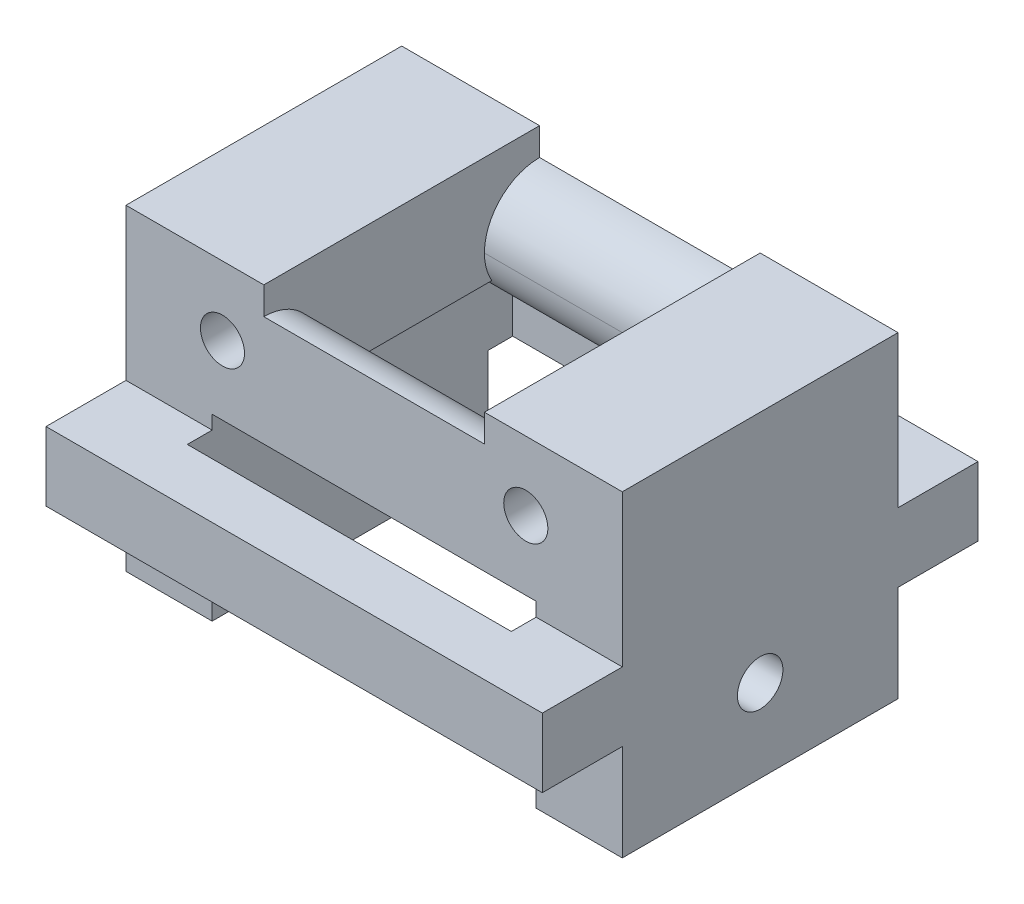
from build123d import *

# Parameters (mm, degrees)
SKETCH1_W           = 36
SKETCH1_H           = 20
BOSS_EXTRUDE1_DEPTH = 15
SKETCH2_W           = 23.5
SKETCH2_H           = 20
CUT_EXTRUDE1_DEPTH  = 13
SKETCH3_R           = 1.65
CUT_EXTRUDE2_DEPTH  = 44.829214002
SKETCH4_W           = 20
SKETCH4_H           = 12
CUT_EXTRUDE3_DEPTH  = 44.829214002
SKETCH5_W           = 10
SKETCH5_H           = 20
BOSS_EXTRUDE2_DEPTH = 8
SKETCH6_R           = 1.6
CUT_EXTRUDE4_DEPTH  = 48.16990566
SKETCH7_W           = 16
SKETCH7_H           = 4
BOSS_EXTRUDE3_DEPTH = 6
FILLET1_R           = 4
FILLET2_R           = 4
FILLET5_R           = 4
SKETCH8_W           = 5.8
SKETCH8_H           = 5
BOSS_EXTRUDE4_DEPTH = 36
SKETCH9_W           = 23.5
SKETCH9_H           = 1.8
CUT_EXTRUDE5_DEPTH  = 48.091825193


# Some blends are built 0.0001 mm under size
with BuildPart() as part:
    # Sketch1 → Boss-Extrude1 (new body)
    with BuildSketch(Plane(origin=(0, 0, 0), x_dir=(1, 0, 0), z_dir=(0, 1, 0))):
        with Locations((18, -10)):
            Rectangle(SKETCH1_W, SKETCH1_H)
    extrude(amount=BOSS_EXTRUDE1_DEPTH)

    # Sketch2 → Cut-Extrude1 (cut)
    with BuildSketch(Plane(origin=(0, 0, 0), x_dir=(-1, 0, 0), z_dir=(0, -1, 0))):
        with Locations((-18, -10)):
            Rectangle(SKETCH2_W, SKETCH2_H)
    extrude(amount=-CUT_EXTRUDE1_DEPTH, mode=Mode.SUBTRACT)

    # Sketch3 → Cut-Extrude2 (cut, through all)
    with BuildSketch(Plane.ZY):
        with Locations((10, 6)):
            Circle(SKETCH3_R)
    extrude(amount=-CUT_EXTRUDE2_DEPTH, mode=Mode.SUBTRACT)

    # Sketch4 → Cut-Extrude3 (cut, through all)
    with BuildSketch(Plane(origin=(0, 15, 0), x_dir=(1, 0, 0), z_dir=(0, 1, 0))):
        with Locations((18, -10)):
            Rectangle(SKETCH4_W, SKETCH4_H)
    extrude(amount=-CUT_EXTRUDE3_DEPTH, mode=Mode.SUBTRACT)

    # Sketch5 → Boss-Extrude2 (add)
    with BuildSketch(Plane(origin=(0, 15, 0), x_dir=(1, 0, 0), z_dir=(0, 1, 0))):
        with Locations((31, -10)):
            Rectangle(SKETCH5_W, SKETCH5_H)
        with Locations((5, -10)):
            Rectangle(SKETCH5_W, SKETCH5_H)
    extrude(amount=BOSS_EXTRUDE2_DEPTH)

    # Sketch6 → Cut-Extrude4 (cut, through all)
    with BuildSketch(Plane(origin=(0, 0, 0), x_dir=(-1, 0, 0), z_dir=(0, 0, -1))):
        with Locations((-29, 18)):
            Circle(SKETCH6_R)
        with Locations((-7, 18)):
            Circle(SKETCH6_R)
    extrude(amount=-CUT_EXTRUDE4_DEPTH, mode=Mode.SUBTRACT)

    # Sketch7 → Boss-Extrude3 (add)
    with BuildSketch(Plane(origin=(0, 15, 0), x_dir=(1, 0, 0), z_dir=(0, 1, 0))):
        with Locations((18, -18)):
            Rectangle(SKETCH7_W, SKETCH7_H)
        with Locations((18, -2)):
            Rectangle(SKETCH7_W, SKETCH7_H)
    extrude(amount=BOSS_EXTRUDE3_DEPTH)

    # Fillet1
    # the kernel refuses this fillet: 4 mm, written as the material it takes off along each edge
    with BuildSketch(Plane(origin=(8, 13, 16), x_dir=(0, 0, 1), z_dir=(1, 0, 0))) as fillet1_piece_1_section:
        with BuildLine():
            CenterArc((FILLET1_R, -FILLET1_R), FILLET1_R, 90, 90)
            Line((0, -FILLET1_R), (0, 0))
            Line((0, 0), (FILLET1_R, 0))
        make_face()
    fillet1_piece_1 = extrude(amount=20, mode=Mode.PRIVATE)
    fillet1_piece_1 = split(fillet1_piece_1, bisect_by=Plane(origin=(10, 13, 16), z_dir=(-1, 0, 0)), keep=Keep.TOP, mode=Mode.PRIVATE)
    fillet1_piece_1 = split(fillet1_piece_1, bisect_by=Plane(origin=(8, 15, 16), z_dir=(0, -1, 0)), keep=Keep.TOP, mode=Mode.PRIVATE)
    add(fillet1_piece_1, mode=Mode.SUBTRACT)
    with BuildSketch(Plane(origin=(8, 13, 16), x_dir=(0, 0, 1), z_dir=(1, 0, 0))) as fillet1_piece_2_section:
        with BuildLine():
            CenterArc((FILLET1_R, -FILLET1_R), FILLET1_R, 90, 90)
            Line((0, -FILLET1_R), (0, 0))
            Line((0, 0), (FILLET1_R, 0))
        make_face()
    fillet1_piece_2 = extrude(amount=20, mode=Mode.PRIVATE)
    fillet1_piece_2 = split(fillet1_piece_2, bisect_by=Plane(origin=(10, 13, 16), z_dir=(1, 0, 0)), keep=Keep.TOP, mode=Mode.PRIVATE)
    fillet1_piece_2 = split(fillet1_piece_2, bisect_by=Plane(origin=(26, 13, 16), z_dir=(-1, 0, 0)), keep=Keep.TOP, mode=Mode.PRIVATE)
    fillet1_piece_2 = split(fillet1_piece_2, bisect_by=Plane(origin=(8, 15, 16), z_dir=(0, -1, 0)), keep=Keep.TOP, mode=Mode.PRIVATE)
    add(fillet1_piece_2, mode=Mode.SUBTRACT)
    with BuildSketch(Plane(origin=(8, 13, 16), x_dir=(0, 0, 1), z_dir=(1, 0, 0))) as fillet1_piece_3_section:
        with BuildLine():
            CenterArc((FILLET1_R, -FILLET1_R), FILLET1_R, 90, 90)
            Line((0, -FILLET1_R), (0, 0))
            Line((0, 0), (FILLET1_R, 0))
        make_face()
    fillet1_piece_3 = extrude(amount=20, mode=Mode.PRIVATE)
    fillet1_piece_3 = split(fillet1_piece_3, bisect_by=Plane(origin=(10, 13, 16), z_dir=(1, 0, 0)), keep=Keep.TOP, mode=Mode.PRIVATE)
    fillet1_piece_3 = split(fillet1_piece_3, bisect_by=Plane(origin=(26, 13, 16), z_dir=(-1, 0, 0)), keep=Keep.TOP, mode=Mode.PRIVATE)
    fillet1_piece_3 = split(fillet1_piece_3, bisect_by=Plane(origin=(8, 15, 16), z_dir=(0, 1, 0)), keep=Keep.TOP, mode=Mode.PRIVATE)
    add(fillet1_piece_3, mode=Mode.SUBTRACT)
    with BuildSketch(Plane(origin=(8, 13, 16), x_dir=(0, 0, 1), z_dir=(1, 0, 0))) as fillet1_piece_4_section:
        with BuildLine():
            CenterArc((FILLET1_R, -FILLET1_R), FILLET1_R, 90, 90)
            Line((0, -FILLET1_R), (0, 0))
            Line((0, 0), (FILLET1_R, 0))
        make_face()
    fillet1_piece_4 = extrude(amount=20, mode=Mode.PRIVATE)
    fillet1_piece_4 = split(fillet1_piece_4, bisect_by=Plane(origin=(26, 13, 16), z_dir=(1, 0, 0)), keep=Keep.TOP, mode=Mode.PRIVATE)
    fillet1_piece_4 = split(fillet1_piece_4, bisect_by=Plane(origin=(8, 15, 16), z_dir=(0, -1, 0)), keep=Keep.TOP, mode=Mode.PRIVATE)
    add(fillet1_piece_4, mode=Mode.SUBTRACT)
    with BuildSketch(Plane(origin=(28, 13, 4), x_dir=(0, 0, -1), z_dir=(-1, 0, 0))) as fillet1_piece_5_section:
        with BuildLine():
            CenterArc((FILLET1_R, -FILLET1_R), FILLET1_R, 90, 90)
            Line((0, -FILLET1_R), (0, 0))
            Line((0, 0), (FILLET1_R, 0))
        make_face()
    fillet1_piece_5 = extrude(amount=20, mode=Mode.PRIVATE)
    fillet1_piece_5 = split(fillet1_piece_5, bisect_by=Plane(origin=(26, 13, 4), z_dir=(1, 0, 0)), keep=Keep.TOP, mode=Mode.PRIVATE)
    fillet1_piece_5 = split(fillet1_piece_5, bisect_by=Plane(origin=(28, 15, 4), z_dir=(0, -1, 0)), keep=Keep.TOP, mode=Mode.PRIVATE)
    add(fillet1_piece_5, mode=Mode.SUBTRACT)
    with BuildSketch(Plane(origin=(28, 13, 4), x_dir=(0, 0, -1), z_dir=(-1, 0, 0))) as fillet1_piece_6_section:
        with BuildLine():
            CenterArc((FILLET1_R, -FILLET1_R), FILLET1_R, 90, 90)
            Line((0, -FILLET1_R), (0, 0))
            Line((0, 0), (FILLET1_R, 0))
        make_face()
    fillet1_piece_6 = extrude(amount=20, mode=Mode.PRIVATE)
    fillet1_piece_6 = split(fillet1_piece_6, bisect_by=Plane(origin=(10, 13, 4), z_dir=(1, 0, 0)), keep=Keep.TOP, mode=Mode.PRIVATE)
    fillet1_piece_6 = split(fillet1_piece_6, bisect_by=Plane(origin=(26, 13, 4), z_dir=(-1, 0, 0)), keep=Keep.TOP, mode=Mode.PRIVATE)
    fillet1_piece_6 = split(fillet1_piece_6, bisect_by=Plane(origin=(28, 15, 4), z_dir=(0, -1, 0)), keep=Keep.TOP, mode=Mode.PRIVATE)
    add(fillet1_piece_6, mode=Mode.SUBTRACT)
    with BuildSketch(Plane(origin=(28, 13, 4), x_dir=(0, 0, -1), z_dir=(-1, 0, 0))) as fillet1_piece_7_section:
        with BuildLine():
            CenterArc((FILLET1_R, -FILLET1_R), FILLET1_R, 90, 90)
            Line((0, -FILLET1_R), (0, 0))
            Line((0, 0), (FILLET1_R, 0))
        make_face()
    fillet1_piece_7 = extrude(amount=20, mode=Mode.PRIVATE)
    fillet1_piece_7 = split(fillet1_piece_7, bisect_by=Plane(origin=(10, 13, 4), z_dir=(1, 0, 0)), keep=Keep.TOP, mode=Mode.PRIVATE)
    fillet1_piece_7 = split(fillet1_piece_7, bisect_by=Plane(origin=(26, 13, 4), z_dir=(-1, 0, 0)), keep=Keep.TOP, mode=Mode.PRIVATE)
    fillet1_piece_7 = split(fillet1_piece_7, bisect_by=Plane(origin=(28, 15, 4), z_dir=(0, 1, 0)), keep=Keep.TOP, mode=Mode.PRIVATE)
    add(fillet1_piece_7, mode=Mode.SUBTRACT)
    with BuildSketch(Plane(origin=(28, 13, 4), x_dir=(0, 0, -1), z_dir=(-1, 0, 0))) as fillet1_piece_8_section:
        with BuildLine():
            CenterArc((FILLET1_R, -FILLET1_R), FILLET1_R, 90, 90)
            Line((0, -FILLET1_R), (0, 0))
            Line((0, 0), (FILLET1_R, 0))
        make_face()
    fillet1_piece_8 = extrude(amount=20, mode=Mode.PRIVATE)
    fillet1_piece_8 = split(fillet1_piece_8, bisect_by=Plane(origin=(10, 13, 4), z_dir=(-1, 0, 0)), keep=Keep.TOP, mode=Mode.PRIVATE)
    fillet1_piece_8 = split(fillet1_piece_8, bisect_by=Plane(origin=(28, 15, 4), z_dir=(0, -1, 0)), keep=Keep.TOP, mode=Mode.PRIVATE)
    add(fillet1_piece_8, mode=Mode.SUBTRACT)

    # Fillet2
    # the kernel refuses this fillet: 4 mm, written as the material it adds along each edge
    with BuildSketch(Plane(origin=(8, 15, 21.535898385), x_dir=(1, 0, 0), z_dir=(0, 0, -1))) as fillet2_piece_1_section:
        with BuildLine():
            CenterArc((3.645751311, 3.645751311), FILLET2_R, 204.295188945, 41.409622109)
            Line((0, 2), (0, 0))
            Line((0, 0), (2, 0))
        make_face()
    fillet2_piece_1 = extrude(amount=23.07179677, mode=Mode.PRIVATE)
    fillet2_piece_1 = split(fillet2_piece_1, bisect_by=Plane(origin=(8, 15, 0), z_dir=(0, 0, 1)), keep=Keep.TOP, mode=Mode.PRIVATE)
    fillet2_piece_1 = split(fillet2_piece_1, bisect_by=Plane(origin=(8, 15, 20), z_dir=(0, 0, -1)), keep=Keep.TOP, mode=Mode.PRIVATE)
    add(fillet2_piece_1)
    with BuildSketch(Plane(origin=(28, 15, -1.535898385), x_dir=(-1, 0, 0), z_dir=(0, 0, 1))) as fillet2_piece_2_section:
        with BuildLine():
            CenterArc((3.645751311, 3.645751311), FILLET2_R, 204.295188945, 41.409622109)
            Line((0, 2), (0, 0))
            Line((0, 0), (2, 0))
        make_face()
    fillet2_piece_2 = extrude(amount=23.07179677, mode=Mode.PRIVATE)
    fillet2_piece_2 = split(fillet2_piece_2, bisect_by=Plane(origin=(28, 15, 0), z_dir=(0, 0, 1)), keep=Keep.TOP, mode=Mode.PRIVATE)
    fillet2_piece_2 = split(fillet2_piece_2, bisect_by=Plane(origin=(28, 15, 20), z_dir=(0, 0, -1)), keep=Keep.TOP, mode=Mode.PRIVATE)
    add(fillet2_piece_2)

    # Fillet5
    fillet5_edges = [part.edges().sort_by_distance(p)[0] for p in [
        (18, 21, 16),
        (18, 21, 4),
    ]]
    fillet(fillet5_edges, radius=FILLET5_R - 0.0001)  # a hair under: the kernel refuses the full size

    # Sketch8 → Boss-Extrude4 (add)
    with BuildSketch(Plane.ZY):
        with Locations((22.9, 9.5)):
            Rectangle(SKETCH8_W, SKETCH8_H)
        with Locations((-2.9, 9.5)):
            Rectangle(SKETCH8_W, SKETCH8_H)
    extrude(amount=-BOSS_EXTRUDE4_DEPTH)

    # Sketch9 → Cut-Extrude5 (cut, through all)
    with BuildSketch(Plane(origin=(0, 7, 0), x_dir=(-1, 0, 0), z_dir=(0, -1, 0))):
        with Locations((-18, 0.9)):
            Rectangle(SKETCH9_W, SKETCH9_H)
        with Locations((-18, -20.9)):
            Rectangle(SKETCH9_W, SKETCH9_H)
    extrude(amount=-CUT_EXTRUDE5_DEPTH, mode=Mode.SUBTRACT)


solid = part.part
